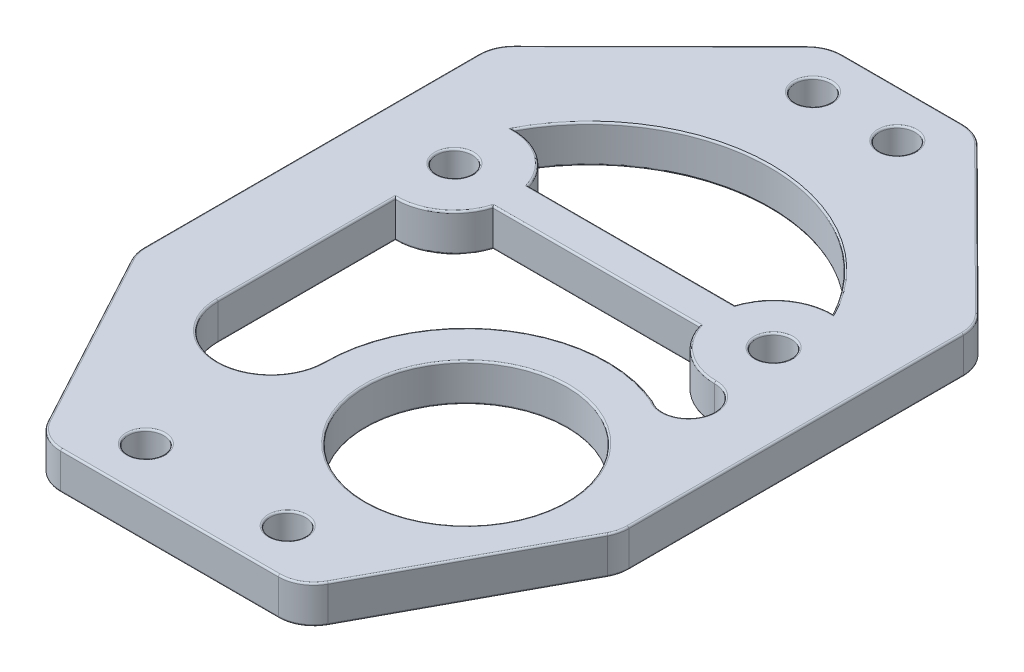
from build123d import *

# Parameters (mm, degrees)
SKETCH1_R           = 1.4999999999999998
SKETCH1_R_2         = 8.499999999999998
SKETCH1_R_3         = 1.5000000000000007
SKETCH1_R_4         = 1.5000000000000009
BOSS_EXTRUDE2_DEPTH = 3.18
FILLET1_R           = 3
FILLET3_R           = 0.15


with BuildPart() as part:
    # Sketch1 → Boss-Extrude2 (new body)
    with BuildSketch(Plane(origin=(0, 0, 0), x_dir=(1, 0, 0), z_dir=(0, 1, 0))):
        Polygon((-11, -1.35e-15), (11, -1.35e-15), (20.5, 17.599715906798043), (20.5, 47.89971590679805), (6.316136334164938, 62), (-6.316136334164937, 62), (-20.5, 47.89971590679805), (-20.5, 17.599715906798043), align=None)
        with Locations((-6, 3.999999999999999)):
            Circle(SKETCH1_R, mode=Mode.SUBTRACT)
        with Locations((6, 3.999999999999999)):
            Circle(SKETCH1_R, mode=Mode.SUBTRACT)
        with Locations((7.500000000000002, 17.59971590679804)):
            Circle(SKETCH1_R_2, mode=Mode.SUBTRACT)
        with Locations((-13.5, 37.599715906798046)):
            Circle(SKETCH1_R_3, mode=Mode.SUBTRACT)
        with Locations((-3.5661363341649484, 57.99999999999999)):
            Circle(SKETCH1_R_4, mode=Mode.SUBTRACT)
        with BuildLine():
            ThreePointArc((-13.500000000000002, 32.59971590679804), (-10.541960108450196, 33.56858703264878), (-8.730303992915275, 36.09971590679805))
            Line((-8.730303992915275, 36.09971590679805), (8.730303992915278, 36.09971590679805))
            ThreePointArc((8.730303992915278, 36.09971590679805), (10.541960108450205, 33.568587032648786), (13.5, 32.59971590679804))
            ThreePointArc((13.500000000000002, 32.59971590679804), (15.585019726439837, 29.746855497152172), (12.233735796901804, 28.626580620084876))
            ThreePointArc((12.233735796901804, 28.62658062008488), (0.8971532488941465, 27.61981644428821), (-4.499999999999997, 17.599715906798043))
            ThreePointArc((-4.499999999999997, 17.599715906798043), (-9, 13.099715906798043), (-13.500000000000004, 17.599715906798043))
            Line((-13.500000000000002, 17.599715906798043), (-13.500000000000002, 32.59971590679804))
        make_face(mode=Mode.SUBTRACT)
        with BuildLine():
            ThreePointArc((13.500000000000002, 42.599715906798046), (10.541960108450198, 41.630844780947314), (8.730303992915275, 39.09971590679804))
            Line((8.730303992915278, 39.09971590679804), (-8.730303992915275, 39.09971590679804))
            ThreePointArc((-8.730303992915275, 39.09971590679804), (-10.541960108450196, 41.630844780947314), (-13.500000000000002, 42.599715906798046))
            ThreePointArc((-13.5, 42.599715906798046), (1.33e-15, 50.771405351609765), (13.500000000000002, 42.59971590679804))
        make_face(mode=Mode.SUBTRACT)
        with Locations((13.500000000000002, 37.599715906798046)):
            Circle(SKETCH1_R_4, mode=Mode.SUBTRACT)
        with Locations((3.5661363341649484, 57.99999999999999)):
            Circle(SKETCH1_R_4, mode=Mode.SUBTRACT)
    extrude(amount=BOSS_EXTRUDE2_DEPTH)

    # Fillet1
    fillet1_edges = [part.edges().sort_by_distance(p)[0] for p in [
        (-6.316136334164938, 1.59, -62),
        (6.316136334164938, 1.59, -62),
        (20.5, 1.59, -47.89971590679805),
        (20.5, 1.59, -17.599715906798043),
        (11, 1.59, 1.35e-15),
        (-11, 1.59, 1.35e-15),
        (-20.5, 1.59, -17.599715906798043),
        (-20.5, 1.59, -47.89971590679805),
    ]]
    fillet(fillet1_edges, radius=FILLET1_R)

    # Fillet3
    fillet3_edges = [part.edges().sort_by_distance(p)[0] for p in [
        (-13.404385339533999, 0, -54.953519079586016),
        (-6.222639416609131, 0, -61.77333180936088),
        (-20.269939335250946, 0, -47.804023181929445),
        (-3.55e-15, 0, -62),
        (-20.5, 0, -32.50478970835219),
        (6.222639416609124, 0, -61.77333180936088),
        (-20.408596926187876, 0, -17.62280994302341),
        (13.404385339533997, 0, -54.953519079586016),
        (-15.995056577199467, 0, -9.253850178641432),
        (20.269939335250946, 0, -47.80402318192945),
        (-10.747240997253462, 0, -0.4236653944023474),
        (20.5, 0, -32.504789708352206),
        (0, 0, 1.35e-15),
        (20.40859692618788, 0, -17.62280994302342),
        (10.747240997253462, 0, -0.42366539440234874),
        (15.995056577199469, 0, -9.253850178641438),
    ]]
    fillet(fillet3_edges, radius=FILLET3_R)
    fillet3_2_edges = [part.edges().sort_by_distance(p)[0] for p in [
        (-13.404385339533999, 3.18, -54.953519079586016),
        (-6.222639416609131, 3.18, -61.77333180936088),
        (-20.269939335250946, 3.18, -47.804023181929445),
        (-3.55e-15, 3.18, -62),
        (-20.5, 3.18, -32.50478970835219),
        (6.222639416609124, 3.18, -61.77333180936088),
        (-20.408596926187876, 3.18, -17.62280994302341),
        (13.404385339533995, 3.18, -54.953519079586016),
        (-15.995056577199467, 3.18, -9.253850178641432),
        (20.269939335250946, 3.18, -47.80402318192945),
        (-10.747240997253462, 3.18, -0.4236653944023474),
        (20.5, 3.18, -32.504789708352206),
        (0, 3.18, 1.35e-15),
        (20.40859692618788, 3.18, -17.62280994302342),
        (10.747240997253462, 3.18, -0.42366539440234874),
        (15.995056577199469, 3.18, -9.253850178641438),
    ]]
    fillet(fillet3_2_edges, radius=FILLET3_R)
    fillet3_3_edges = [part.edges().sort_by_distance(p)[0] for p in [
        (-7.5, 0, -3.999999999999999),
    ]]
    fillet(fillet3_3_edges, radius=FILLET3_R)
    fillet3_4_edges = [part.edges().sort_by_distance(p)[0] for p in [
        (4.5, 0, -3.999999999999999),
    ]]
    fillet(fillet3_4_edges, radius=FILLET3_R)
    fillet3_5_edges = [part.edges().sort_by_distance(p)[0] for p in [
        (-0.9999999999999964, 0, -17.59971590679804),
    ]]
    fillet(fillet3_5_edges, radius=FILLET3_R)
    fillet3_6_edges = [part.edges().sort_by_distance(p)[0] for p in [
        (-15, 0, -37.599715906798046),
    ]]
    fillet(fillet3_6_edges, radius=FILLET3_R)
    fillet3_7_edges = [part.edges().sort_by_distance(p)[0] for p in [
        (-5.066136334164949, 0, -57.99999999999999),
    ]]
    fillet(fillet3_7_edges, radius=FILLET3_R)
    fillet3_8_edges = [part.edges().sort_by_distance(p)[0] for p in [
        (0.8971532488941456, 0, -27.61981644428821),
        (-9, 0, -13.099715906798043),
        (-13.500000000000002, 0, -25.09971590679804),
        (-10.541960108450196, 0, -33.56858703264878),
        (1.78e-15, 0, -36.09971590679805),
        (10.541960108450205, 0, -33.568587032648786),
        (15.585019726439839, 0, -29.746855497152172),
    ]]
    fillet(fillet3_8_edges, radius=FILLET3_R)
    fillet3_9_edges = [part.edges().sort_by_distance(p)[0] for p in [
        (10.541960108450196, 0, -41.630844780947314),
        (1.78e-15, 0, -39.09971590679804),
        (-10.541960108450196, 0, -41.630844780947314),
        (3.11e-15, 0, -50.771405351609765),
    ]]
    fillet(fillet3_9_edges, radius=FILLET3_R)
    fillet3_10_edges = [part.edges().sort_by_distance(p)[0] for p in [
        (12, 0, -37.599715906798046),
    ]]
    fillet(fillet3_10_edges, radius=FILLET3_R)
    fillet3_11_edges = [part.edges().sort_by_distance(p)[0] for p in [
        (2.0661363341649475, 0, -57.99999999999999),
    ]]
    fillet(fillet3_11_edges, radius=FILLET3_R)
    fillet3_12_edges = [part.edges().sort_by_distance(p)[0] for p in [
        (-7.5, 3.18, -3.999999999999999),
    ]]
    fillet(fillet3_12_edges, radius=FILLET3_R)
    fillet3_13_edges = [part.edges().sort_by_distance(p)[0] for p in [
        (4.5, 3.18, -3.999999999999999),
    ]]
    fillet(fillet3_13_edges, radius=FILLET3_R)
    fillet3_14_edges = [part.edges().sort_by_distance(p)[0] for p in [
        (-0.9999999999999964, 3.18, -17.59971590679804),
    ]]
    fillet(fillet3_14_edges, radius=FILLET3_R)
    fillet3_15_edges = [part.edges().sort_by_distance(p)[0] for p in [
        (-15, 3.18, -37.599715906798046),
    ]]
    fillet(fillet3_15_edges, radius=FILLET3_R)
    fillet3_16_edges = [part.edges().sort_by_distance(p)[0] for p in [
        (-5.066136334164949, 3.18, -57.99999999999999),
    ]]
    fillet(fillet3_16_edges, radius=FILLET3_R)
    fillet3_17_edges = [part.edges().sort_by_distance(p)[0] for p in [
        (0.8971532488941456, 3.18, -27.61981644428821),
        (-9, 3.18, -13.099715906798043),
        (-13.500000000000002, 3.18, -25.09971590679804),
        (-10.541960108450196, 3.18, -33.56858703264878),
        (1.78e-15, 3.18, -36.09971590679805),
        (10.541960108450205, 3.18, -33.568587032648786),
        (15.585019726439839, 3.18, -29.746855497152172),
    ]]
    fillet(fillet3_17_edges, radius=FILLET3_R)
    fillet3_18_edges = [part.edges().sort_by_distance(p)[0] for p in [
        (10.541960108450196, 3.18, -41.630844780947314),
        (1.78e-15, 3.18, -39.09971590679804),
        (-10.541960108450196, 3.18, -41.630844780947314),
        (3.11e-15, 3.18, -50.771405351609765),
    ]]
    fillet(fillet3_18_edges, radius=FILLET3_R)
    fillet3_19_edges = [part.edges().sort_by_distance(p)[0] for p in [
        (12, 3.18, -37.599715906798046),
    ]]
    fillet(fillet3_19_edges, radius=FILLET3_R)
    fillet3_20_edges = [part.edges().sort_by_distance(p)[0] for p in [
        (2.0661363341649475, 3.18, -57.99999999999999),
    ]]
    fillet(fillet3_20_edges, radius=FILLET3_R)


solid = part.part
